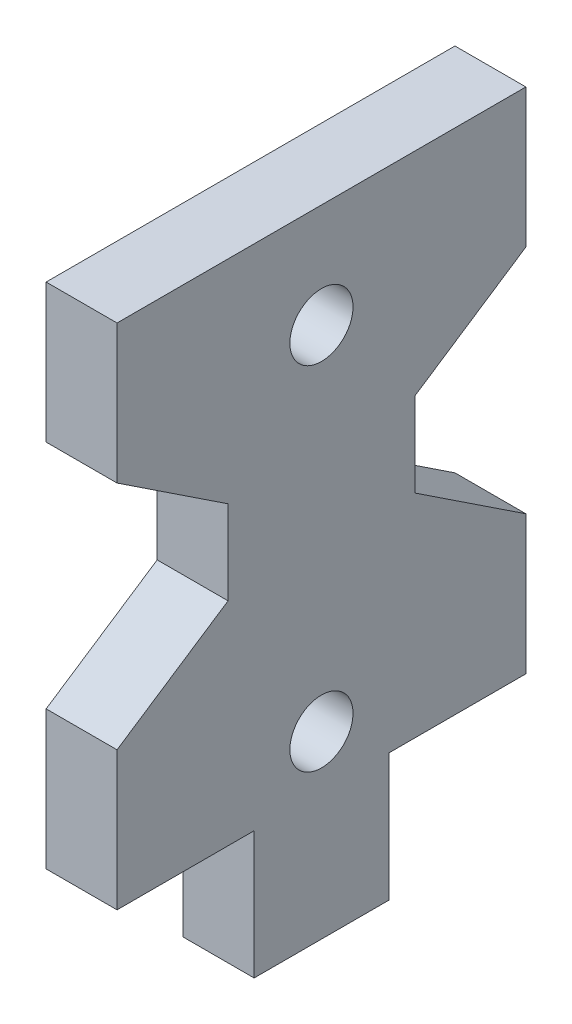
from build123d import *

# Parameters (mm, degrees)
SKETCH1_R            = 1.75
BOSS_EXTRUDE1_DEPTH  = 3.175
SHELL1_START         = -13.3528
SHELL1_OUTLINE_W     = 3.5306
SHELL1_OUTLINE_H     = 6.35
SHELL1_DEPTH         = 0.1778
SHELL1_START_2       = -6.825
SHELL1_2_OUTLINE_W   = 3.5306
SHELL1_2_OUTLINE_H   = 6.35
SHELL1_2_DEPTH       = 0.1778
SHELL1_START_3       = -20.1778
SHELL1_3_OUTLINE_W   = 3.5306
SHELL1_3_OUTLINE_H   = 25.3075948
SHELL1_3_DEPTH       = 20.3556
SHELL1_START_4       = -13.175
SHELL1_4_OUTLINE_W   = 3.5306
SHELL1_4_OUTLINE_H   = 6.35
SHELL1_4_DEPTH       = 6.35
SHELL1_5_OUTLINE_R   = 1.75
SHELL1_5_OUTLINE_R_2 = 1.5722
SHELL1_5_DEPTH       = 3.175
SHELL1_START_5       = -0.1778
SHELL1_6_OUTLINE_R   = 1.5722
SHELL1_6_DEPTH       = 3.5306


with BuildPart() as part:
    # Sketch1 → Boss-Extrude1 (new body)
    with BuildSketch(Plane(origin=(0, 0, 0), x_dir=(0, 0, -1), z_dir=(1, 0, 0))):
        Polygon((0, 0), (6.825, 0), (6.825, -6.35), (13.175, -6.35), (13.175, 0), (20, 0), (20, 6.629574014), (14.471500996, 10.288392178), (14.471500996, 14.663602622), (20, 18.322420786), (20, 24.9519948), (0, 24.9519948), (0, 18.322420786), (5.528499004, 14.663602622), (5.528499004, 10.288392178), (0, 6.629574014), align=None)
        with Locations((10, 19.9519948)):
            Circle(SKETCH1_R, mode=Mode.SUBTRACT)
        with Locations((10, 2.4259948)):
            Circle(SKETCH1_R, mode=Mode.SUBTRACT)
    extrude(amount=BOSS_EXTRUDE1_DEPTH)

    # Shell1: read off the stored shape, not the designer's step
    # Shell1 outline → Shell1 (add)
    with BuildSketch(Plane.XY.offset(SHELL1_START)):
        with Locations((1.5875, -3.3528)):
            Rectangle(SHELL1_OUTLINE_W, SHELL1_OUTLINE_H)
    extrude(amount=SHELL1_DEPTH)

    # Shell1 2 outline → Shell1 2 (add)
    with BuildSketch(Plane.XY.offset(SHELL1_START_2)):
        with Locations((1.5875, -3.3528)):
            Rectangle(SHELL1_2_OUTLINE_W, SHELL1_2_OUTLINE_H)
    extrude(amount=SHELL1_2_DEPTH)

    # Shell1 3 outline → Shell1 3 (add)
    with BuildSketch(Plane.XY.offset(SHELL1_START_3)):
        with Locations((1.5875, 12.4759974)):
            Rectangle(SHELL1_3_OUTLINE_W, SHELL1_3_OUTLINE_H)
    extrude(amount=SHELL1_3_DEPTH)

    # Shell1 4 outline → Shell1 4 (add)
    with BuildSketch(Plane.XY.offset(SHELL1_START_4)):
        with Locations((1.5875, -3.3528)):
            Rectangle(SHELL1_4_OUTLINE_W, SHELL1_4_OUTLINE_H)
    extrude(amount=SHELL1_4_DEPTH)

    # Shell1 5 outline → Shell1 5 (cut)
    # profile 1 of 5: a face of its own
    with BuildSketch(Plane.YZ):
        Polygon((14.568061248, -14.649300996), (10.383933552, -14.649300996), (6.725115387, -20.1778), (18.226879413, -20.1778), align=None)
    # profile 2 of 5: a face of its own
    with BuildSketch(Plane.YZ):
        Polygon((10.383933552, -5.350699004), (14.568061248, -5.350699004), (18.226879413, 0.1778), (6.725115387, 0.1778), align=None)
    # profile 3 of 5: a face of its own
    with BuildSketch(Plane.YZ):
        Polygon((6.629574014, 0), (0, 0), (0, -6.825), (-6.35, -6.825), (-6.35, -13.175), (0, -13.175), (0, -20), (6.629574014, -20), (10.288392178, -14.471500996), (14.663602622, -14.471500996), (18.322420786, -20), (24.9519948, -20), (24.9519948, 0), (18.322420786, 0), (14.663602622, -5.528499004), (10.288392178, -5.528499004), align=None)
        with Locations((2.4259948, -10)):
            Circle(SHELL1_5_OUTLINE_R, mode=Mode.SUBTRACT)
        with Locations((19.9519948, -10)):
            Circle(SHELL1_5_OUTLINE_R, mode=Mode.SUBTRACT)
    # profile 4 of 5: a face of its own
    with BuildSketch(Plane.YZ):
        with Locations((2.4259948, -10)):
            Circle(SHELL1_5_OUTLINE_R_2)
    # profile 5 of 5: a face of its own
    with BuildSketch(Plane.YZ):
        with Locations((19.9519948, -10)):
            Circle(SHELL1_5_OUTLINE_R_2)
    extrude(amount=SHELL1_5_DEPTH, mode=Mode.SUBTRACT)

    # Shell1 6 outline → Shell1 6 (cut)
    with BuildSketch(Plane.YZ.offset(SHELL1_START_5)):
        Polygon((14.568061248, -14.649300996), (10.383933552, -14.649300996), (6.725115387, -20.1778), (18.226879413, -20.1778), align=None)
        Polygon((10.383933552, -5.350699004), (14.568061248, -5.350699004), (18.226879413, 0.1778), (6.725115387, 0.1778), align=None)
        with Locations((19.9519948, -10)):
            Circle(SHELL1_6_OUTLINE_R)
        with Locations((2.4259948, -10)):
            Circle(SHELL1_6_OUTLINE_R)
    extrude(amount=SHELL1_6_DEPTH, mode=Mode.SUBTRACT)


solid = part.part
